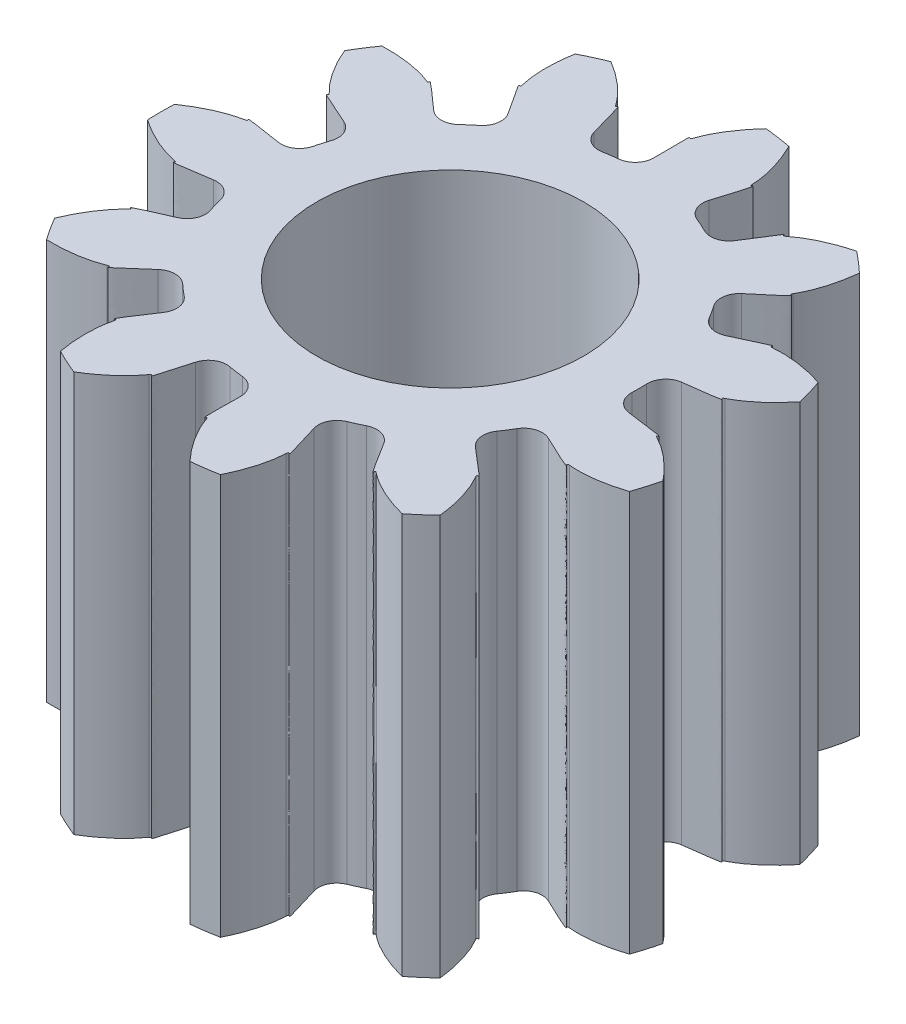
from build123d import *

# Parameters (mm, degrees)
BOSS_EXTRUDE1_DEPTH      = 4.5
F_3_0_3_DIAMETER_HOLE1_D = 3
FILLET1_R                = 0.2070222


with BuildPart() as part:
    # Sketch1 → Boss-Extrude1 (new body)
    with BuildSketch(Plane.XZ.offset(4.5)):
        with BuildLine():
            Line((-2.127148653, 0.933283839), (-1.945909761, 0.853850226))
            ThreePointArc((-1.945909761, 0.853850226), (-2.038922571, 0.598681683), (-2.098629746, 0.333733724))
            Line((-2.098629746, 0.333733724), (-2.294042653, 0.364895059))
            add(Edge.make_bspline(
                [(-2.294042653, 0.364895059), (-2.872825872, 0.457149124), (-2.616328289, 0.411215945), (-2.701603854, 0.39539547)],
                knots=[0, 0, 0, 0, 1, 1, 1, 1], degree=3))
            add(Edge.make_bspline(
                [(-2.701603854, 0.39539547), (-2.965301701, 0.345948118), (-3.246475227, 0.151322907)],
                knots=[0.722131982, 0.722131982, 0.722131982, 1.346897929, 1.346897929, 1.346897929], degree=2, weights=[1, 0.95160392, 1]))
            ThreePointArc((-3.246475227, 0.151322907), (-3.250000004, 1e-09), (-3.246475227, -0.151322905))
            add(Edge.make_bspline(
                [(-3.246475227, -0.151322905), (-2.965301701, -0.345948117), (-2.701603854, -0.395395469)],
                knots=[4.936287368, 4.936287368, 4.936287368, 5.561053319, 5.561053319, 5.561053319], degree=2, weights=[1, 0.951603919, 1]))
            add(Edge.make_bspline(
                [(-2.294042653, -0.364895059), (-2.872825872, -0.457149123), (-2.616328288, -0.411215944), (-2.701603854, -0.395395469)],
                knots=[0, 0, 0, 0, 1, 1, 1, 1], degree=3))
            Line((-2.294042653, -0.364895059), (-2.098629746, -0.333733724))
            ThreePointArc((-2.098629746, -0.333733724), (-2.038922571, -0.598681683), (-1.945909761, -0.853850226))
            Line((-1.945909761, -0.853850226), (-2.12714865, -0.933283837))
            add(Edge.make_bspline(
                [(-2.12714865, -0.933283837), (-2.66392839, -1.168588612), (-2.423315541, -1.068556997), (-2.486500717, -1.127969479)],
                knots=[0, 0, 0, 0, 1, 1, 1, 1], degree=3))
            add(Edge.make_bspline(
                [(-2.486500717, -1.127969479), (-2.681604181, -1.312133087), (-2.812920095, -1.627876089)],
                knots=[3.863718584, 3.863718584, 3.863718584, 4.488476819, 4.488476819, 4.488476819], degree=2, weights=[1, 0.951605105, 1]))
            ThreePointArc((-2.812920095, -1.627876089), (-2.734073986, -1.757082657), (-2.649297416, -1.882477948))
            add(Edge.make_bspline(
                [(-2.649297416, -1.882477948), (-2.307536876, -1.894193176), (-2.058966857, -1.79322515)],
                knots=[4.93630113, 4.93630113, 4.93630113, 5.56105937, 5.56105937, 5.56105937], degree=2, weights=[1, 0.951605104, 1]))
            add(Edge.make_bspline(
                [(-1.732594324, -1.547222352), (-2.169621439, -1.937745242), (-1.978675291, -1.760430729), (-2.058966857, -1.79322515)],
                knots=[0, 0, 0, 0, 1, 1, 1, 1], degree=3))
            Line((-1.732594324, -1.547222352), (-1.585049615, -1.415359575))
            ThreePointArc((-1.585049615, -1.415359575), (-1.391579061, -1.605967846), (-1.175377177, -1.770342762))
            Line((-1.175377177, -1.770342762), (-1.284899981, -1.935151709))
            add(Edge.make_bspline(
                [(-1.284899981, -1.935151709), (-1.609252468, -2.42330772), (-1.460917232, -2.209070643), (-1.481951171, -2.293212089)],
                knots=[0, 0, 0, 0, 1, 1, 1, 1], degree=3))
            add(Edge.make_bspline(
                [(-1.481951171, -2.293212089), (-1.546516287, -2.553621271), (-1.486282708, -2.89023593)],
                knots=[0.72212593, 0.72212593, 0.72212593, 1.346884166, 1.346884166, 1.346884166], degree=2, weights=[1, 0.951605105, 1]))
            ThreePointArc((-1.486282708, -2.89023593), (-1.350098796, -2.956303986), (-1.210986394, -3.015959544))
            add(Edge.make_bspline(
                [(-1.210986394, -3.015959544), (-0.917145403, -2.841045323), (-0.762622432, -2.621718516)],
                knots=[1.794708477, 1.794708477, 1.794708477, 2.419466717, 2.419466717, 2.419466717], degree=2, weights=[1, 0.951605104, 1]))
            add(Edge.make_bspline(
                [(-0.621059539, -2.23831748), (-0.777577529, -2.803120937), (-0.712806871, -2.550721196), (-0.762622432, -2.621718516)],
                knots=[0, 0, 0, 0, 1, 1, 1, 1], degree=3))
            Line((-0.621059539, -2.23831748), (-0.568227431, -2.047618761))
            ThreePointArc((-0.568227431, -2.047618761), (-0.302419033, -2.103370564), (-0.031670645, -2.12476398))
            Line((-0.031670645, -2.12476398), (-0.034704647, -2.322622587))
            add(Edge.make_bspline(
                [(-0.034704647, -2.322622587), (-0.043650258, -2.908643749), (-0.034688024, -2.648219968), (-0.006892601, -2.730376063)],
                knots=[0, 0, 0, 0, 1, 1, 1, 1], degree=3))
            add(Edge.make_bspline(
                [(-0.006892601, -2.730376063), (0.079579601, -2.984352744), (0.312238936, -3.234966284)],
                knots=[0.72212593, 0.72212593, 0.72212593, 1.346884166, 1.346884166, 1.346884166], degree=2, weights=[1, 0.951605105, 1]))
            ThreePointArc((0.312238936, -3.234966284), (0.462523221, -3.216919688), (0.611804251, -3.191895294))
            add(Edge.make_bspline(
                [(0.611804251, -3.191895294), (0.764433256, -2.885885654), (0.775849227, -2.617834778)],
                knots=[1.794708476, 1.794708476, 1.794708476, 2.419466716, 2.419466716, 2.419466716], degree=2, weights=[1, 0.951605104, 1]))
            add(Edge.make_bspline(
                [(0.68765726, -2.218762624), (0.861341751, -2.778525541), (0.779372694, -2.531175706), (0.775849227, -2.617834778)],
                knots=[0, 0, 0, 0, 1, 1, 1, 1], degree=3))
            Line((0.68765726, -2.218762624), (0.629002946, -2.029773458))
            ThreePointArc((0.629002946, -2.029773458), (0.882756901, -1.93296799), (1.122091093, -1.804587647))
            Line((1.122091093, -1.804587647), (1.226509167, -1.972677204))
            add(Edge.make_bspline(
                [(1.226509167, -1.972677204), (1.5358106, -2.470505939), (1.402554385, -2.246578165), (1.470354322, -2.300664929)],
                knots=[0, 0, 0, 0, 1, 1, 1, 1], degree=3))
            add(Edge.make_bspline(
                [(1.470354322, -2.300664929), (1.680409527, -2.467573308), (2.011626924, -2.5526177)],
                knots=[3.863718584, 3.863718584, 3.863718584, 4.488476819, 4.488476819, 4.488476819], degree=2, weights=[1, 0.951605105, 1]))
            ThreePointArc((2.011626924, -2.5526177), (2.128297384, -2.456186119), (2.240351368, -2.354426842))
            add(Edge.make_bspline(
                [(2.240351368, -2.354426842), (2.203309756, -2.014477681), (2.067994237, -1.782806994)],
                knots=[4.93630113, 4.93630113, 4.93630113, 5.56105937, 5.56105937, 5.56105937], degree=2, weights=[1, 0.951605104, 1]))
            add(Edge.make_bspline(
                [(1.778047738, -1.494766311), (2.226791111, -1.871767918), (2.024106935, -1.707999814), (2.067994237, -1.782806994)],
                knots=[0, 0, 0, 0, 1, 1, 1, 1], degree=3))
            Line((1.778047738, -1.494766311), (1.626529332, -1.367489424))
            ThreePointArc((1.626529332, -1.367489424), (1.787663755, -1.148861737), (1.919596836, -0.911467487))
            Line((1.919596836, -0.911467487), (2.098314985, -0.996420747))
            add(Edge.make_bspline(
                [(2.098314985, -0.996420747), (2.627662444, -1.24799995), (2.394495686, -1.131663668), (2.480774135, -1.140508936)],
                knots=[0, 0, 0, 0, 1, 1, 1, 1], degree=3))
            add(Edge.make_bspline(
                [(2.480774135, -1.140508936), (2.747721301, -1.167356781), (3.072337576, -1.059831033)],
                knots=[3.863718584, 3.863718584, 3.863718584, 4.48847682, 4.48847682, 4.48847682], degree=2, weights=[1, 0.951605105, 1]))
            ThreePointArc((3.072337576, -1.059831033), (3.118352164, -0.915630812), (3.157602755, -0.769444502))
            add(Edge.make_bspline(
                [(3.157602755, -0.769444502), (2.942650976, -0.503487277), (2.703565688, -0.381750587)],
                knots=[4.93630113, 4.93630113, 4.93630113, 5.56105937, 5.56105937, 5.56105937], degree=2, weights=[1, 0.951605104, 1]))
            add(Edge.make_bspline(
                [(2.303920621, -0.296192257), (2.885250026, -0.370737206), (2.626201525, -0.342546049), (2.703565688, -0.381750587)],
                knots=[0, 0, 0, 0, 1, 1, 1, 1], degree=3))
            Line((2.303920621, -0.296192257), (2.107644147, -0.271037161))
            ThreePointArc((2.107644147, -0.271037161), (2.124999998, 0), (2.107644147, 0.27103716))
            Line((2.107644147, 0.27103716), (2.303920622, 0.296192256))
            add(Edge.make_bspline(
                [(2.303920622, 0.296192256), (2.885250027, 0.370737206), (2.626201525, 0.342546048), (2.703565689, 0.381750586)],
                knots=[0, 0, 0, 0, 1, 1, 1, 1], degree=3))
            add(Edge.make_bspline(
                [(2.703565689, 0.381750586), (2.942650976, 0.503487275), (3.157602756, 0.769444499)],
                knots=[0.72212593, 0.72212593, 0.72212593, 1.346884166, 1.346884166, 1.346884166], degree=2, weights=[1, 0.951605105, 1]))
            ThreePointArc((3.157602756, 0.769444499), (3.118352165, 0.915630809), (3.072337577, 1.05983103))
            add(Edge.make_bspline(
                [(3.072337577, 1.05983103), (2.747721302, 1.167356779), (2.480774135, 1.140508935)],
                knots=[1.794708476, 1.794708476, 1.794708476, 2.419466716, 2.419466716, 2.419466716], degree=2, weights=[1, 0.951605104, 1]))
            add(Edge.make_bspline(
                [(2.098314985, 0.996420746), (2.627662443, 1.247999949), (2.394495686, 1.131663667), (2.480774135, 1.140508935)],
                knots=[0, 0, 0, 0, 1, 1, 1, 1], degree=3))
            Line((2.098314985, 0.996420746), (1.919596836, 0.911467487))
            ThreePointArc((1.919596836, 0.911467487), (1.787663755, 1.148861737), (1.626529332, 1.367489424))
            Line((1.626529332, 1.367489424), (1.778047739, 1.494766311))
            add(Edge.make_bspline(
                [(1.778047739, 1.494766311), (2.226791112, 1.871767918), (2.024106936, 1.707999813), (2.067994238, 1.782806994)],
                knots=[0, 0, 0, 0, 1, 1, 1, 1], degree=3))
            add(Edge.make_bspline(
                [(2.067994238, 1.782806994), (2.203309757, 2.014477679), (2.24035137, 2.354426839)],
                knots=[0.72212593, 0.72212593, 0.72212593, 1.346884166, 1.346884166, 1.346884166], degree=2, weights=[1, 0.951605105, 1]))
            ThreePointArc((2.24035137, 2.354426839), (2.128297386, 2.456186117), (2.011626926, 2.552617698))
            add(Edge.make_bspline(
                [(2.011626926, 2.552617698), (1.680409529, 2.467573306), (1.470354322, 2.300664928)],
                knots=[1.794708477, 1.794708477, 1.794708477, 2.419466717, 2.419466717, 2.419466717], degree=2, weights=[1, 0.951605104, 1]))
            add(Edge.make_bspline(
                [(1.226509167, 1.972677203), (1.535810601, 2.470505939), (1.402554385, 2.246578164), (1.470354322, 2.300664928)],
                knots=[0, 0, 0, 0, 1, 1, 1, 1], degree=3))
            Line((1.226509167, 1.972677203), (1.122091093, 1.804587647))
            ThreePointArc((1.122091093, 1.804587647), (0.882756901, 1.93296799), (0.629002946, 2.029773458))
            Line((0.629002946, 2.029773458), (0.687657261, 2.218762624))
            add(Edge.make_bspline(
                [(0.687657261, 2.218762624), (0.861341752, 2.778525542), (0.779372695, 2.531175706), (0.775849228, 2.617834778)],
                knots=[0, 0, 0, 0, 1, 1, 1, 1], degree=3))
            add(Edge.make_bspline(
                [(0.775849228, 2.617834778), (0.764433257, 2.885885654), (0.611804253, 3.191895293)],
                knots=[0.72212593, 0.72212593, 0.72212593, 1.346884166, 1.346884166, 1.346884166], degree=2, weights=[1, 0.951605105, 1]))
            ThreePointArc((0.611804253, 3.191895293), (0.462523224, 3.216919688), (0.312238939, 3.234966283))
            add(Edge.make_bspline(
                [(0.312238939, 3.234966283), (0.079579603, 2.984352744), (-0.0068926, 2.730376062)],
                knots=[1.794708477, 1.794708477, 1.794708477, 2.419466717, 2.419466717, 2.419466717], degree=2, weights=[1, 0.951605104, 1]))
            add(Edge.make_bspline(
                [(-0.034704646, 2.322622586), (-0.043650257, 2.908643748), (-0.034688024, 2.648219967), (-0.0068926, 2.730376062)],
                knots=[0, 0, 0, 0, 1, 1, 1, 1], degree=3))
            Line((-0.034704646, 2.322622586), (-0.031670645, 2.12476398))
            ThreePointArc((-0.031670645, 2.12476398), (-0.302419033, 2.103370564), (-0.568227431, 2.047618761))
            Line((-0.568227431, 2.047618761), (-0.621059539, 2.23831748))
            add(Edge.make_bspline(
                [(-0.621059539, 2.23831748), (-0.777577528, 2.803120938), (-0.71280687, 2.550721197), (-0.762622431, 2.621718517)],
                knots=[0, 0, 0, 0, 1, 1, 1, 1], degree=3))
            add(Edge.make_bspline(
                [(-0.762622431, 2.621718517), (-0.917145401, 2.841045324), (-1.210986391, 3.015959545)],
                knots=[0.72212593, 0.72212593, 0.72212593, 1.346884166, 1.346884166, 1.346884166], degree=2, weights=[1, 0.951605105, 1]))
            ThreePointArc((-1.210986391, 3.015959545), (-1.350098794, 2.956303987), (-1.486282706, 2.890235931))
            add(Edge.make_bspline(
                [(-1.486282706, 2.890235931), (-1.546516285, 2.553621272), (-1.481951171, 2.293212089)],
                knots=[1.794708476, 1.794708476, 1.794708476, 2.419466716, 2.419466716, 2.419466716], degree=2, weights=[1, 0.951605104, 1]))
            add(Edge.make_bspline(
                [(-1.28489998, 1.935151709), (-1.609252467, 2.423307719), (-1.460917231, 2.209070643), (-1.481951171, 2.293212089)],
                knots=[0, 0, 0, 0, 1, 1, 1, 1], degree=3))
            Line((-1.28489998, 1.935151709), (-1.175377177, 1.770342762))
            ThreePointArc((-1.175377177, 1.770342762), (-1.391579061, 1.605967845), (-1.585049615, 1.415359574))
            Line((-1.585049615, 1.415359574), (-1.732594324, 1.547222352))
            add(Edge.make_bspline(
                [(-1.732594324, 1.547222352), (-2.169621438, 1.937745242), (-1.978675291, 1.76043073), (-2.058966857, 1.793225151)],
                knots=[0, 0, 0, 0, 1, 1, 1, 1], degree=3))
            add(Edge.make_bspline(
                [(-2.058966857, 1.793225151), (-2.307536875, 1.894193177), (-2.649297414, 1.88247795)],
                knots=[0.72212593, 0.72212593, 0.72212593, 1.346884166, 1.346884166, 1.346884166], degree=2, weights=[1, 0.951605105, 1]))
            ThreePointArc((-2.649297414, 1.88247795), (-2.734073985, 1.757082658), (-2.812920095, 1.627876089))
            add(Edge.make_bspline(
                [(-2.812920095, 1.627876089), (-2.681604182, 1.312133089), (-2.486500719, 1.127969482)],
                knots=[1.794708484, 1.794708484, 1.794708484, 2.419466718, 2.419466718, 2.419466718], degree=2, weights=[1, 0.951605105, 1]))
            add(Edge.make_bspline(
                [(-2.127148653, 0.933283839), (-2.663928393, 1.168588614), (-2.423315543, 1.068556999), (-2.486500719, 1.127969482)],
                knots=[0, 0, 0, 0, 1, 1, 1, 1], degree=3))
        make_face()
    extrude(amount=-BOSS_EXTRUDE1_DEPTH)

    # Ø3.0 (3) Diameter Hole1 (through all)
    with Locations(Plane(origin=(0, -4.5, 0), x_dir=(-1, 0, 0), z_dir=(0, -1, 0))):
        with Locations((0, 0)):
            Hole(F_3_0_3_DIAMETER_HOLE1_D / 2)

    # Fillet1
    fillet1_edges = [part.edges().sort_by_distance(p)[0] for p in [
        (-1.175377177, -2.25, -1.770342762),
        (-0.031670645, -2.25, -2.12476398),
        (-1.945909761, -2.25, -0.853850226),
        (-1.585049615, -2.25, 1.415359574),
        (-0.568227431, -2.25, -2.047618761),
        (-1.945909761, -2.25, 0.853850226),
        (-1.585049615, -2.25, -1.415359575),
        (1.919596836, -2.25, -0.911467487),
        (-2.098629746, -2.25, -0.333733724),
        (2.107644147, -2.25, -0.271037161),
        (1.122091093, -2.25, 1.804587647),
        (1.626529332, -2.25, -1.367489424),
        (0.629002946, -2.25, 2.029773458),
        (2.107644147, -2.25, 0.27103716),
        (-0.031670645, -2.25, 2.12476398),
        (1.122091093, -2.25, -1.804587647),
        (-0.568227431, -2.25, 2.047618761),
        (1.919596836, -2.25, 0.911467487),
        (-1.175377177, -2.25, 1.770342762),
        (0.629002946, -2.25, -2.029773458),
        (1.626529332, -2.25, 1.367489424),
        (-2.098629746, -2.25, 0.333733724),
    ]]
    fillet(fillet1_edges, radius=FILLET1_R - 0.0001)  # a hair under: the kernel refuses the full size


solid = part.part
